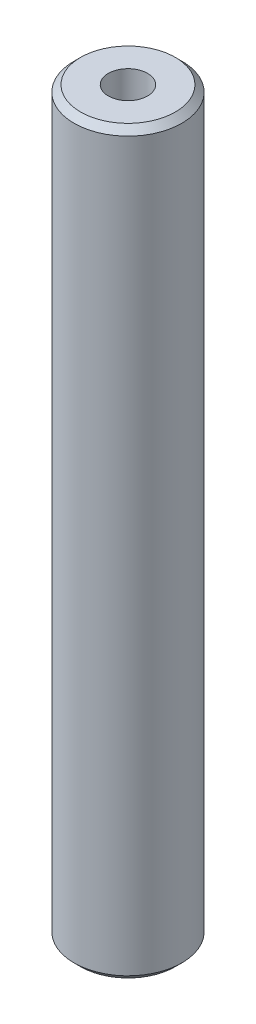
from build123d import *

# Parameters (mm, degrees)
SKETCH1_R           = 35
BOSS_EXTRUDE1_DEPTH = 480.846947888
SKETCH2_R           = 12.748282878
CUT_EXTRUDE1_DEPTH  = 484.387822864
CHAMFER1_SIZE       = 4.223235268


with BuildPart() as part:
    # Sketch1 → Boss-Extrude1 (new body)
    with BuildSketch(Plane(origin=(0, 0, 0), x_dir=(1, 0, 0), z_dir=(0, 1, 0))):
        Circle(SKETCH1_R)
    extrude(amount=BOSS_EXTRUDE1_DEPTH)

    # Sketch2 → Cut-Extrude1 (cut, through all)
    with BuildSketch(Plane(origin=(0, 0, 0), x_dir=(1, 0, 0), z_dir=(0, 1, 0))):
        Circle(SKETCH2_R)
    extrude(amount=CUT_EXTRUDE1_DEPTH, mode=Mode.SUBTRACT)

    # Chamfer1
    chamfer1_edges = [part.edges().sort_by_distance(p)[0] for p in [
        (-35, 480.846947888, 0),
        (-35, 0, 0),
    ]]
    chamfer(chamfer1_edges, length=CHAMFER1_SIZE)


solid = part.part
